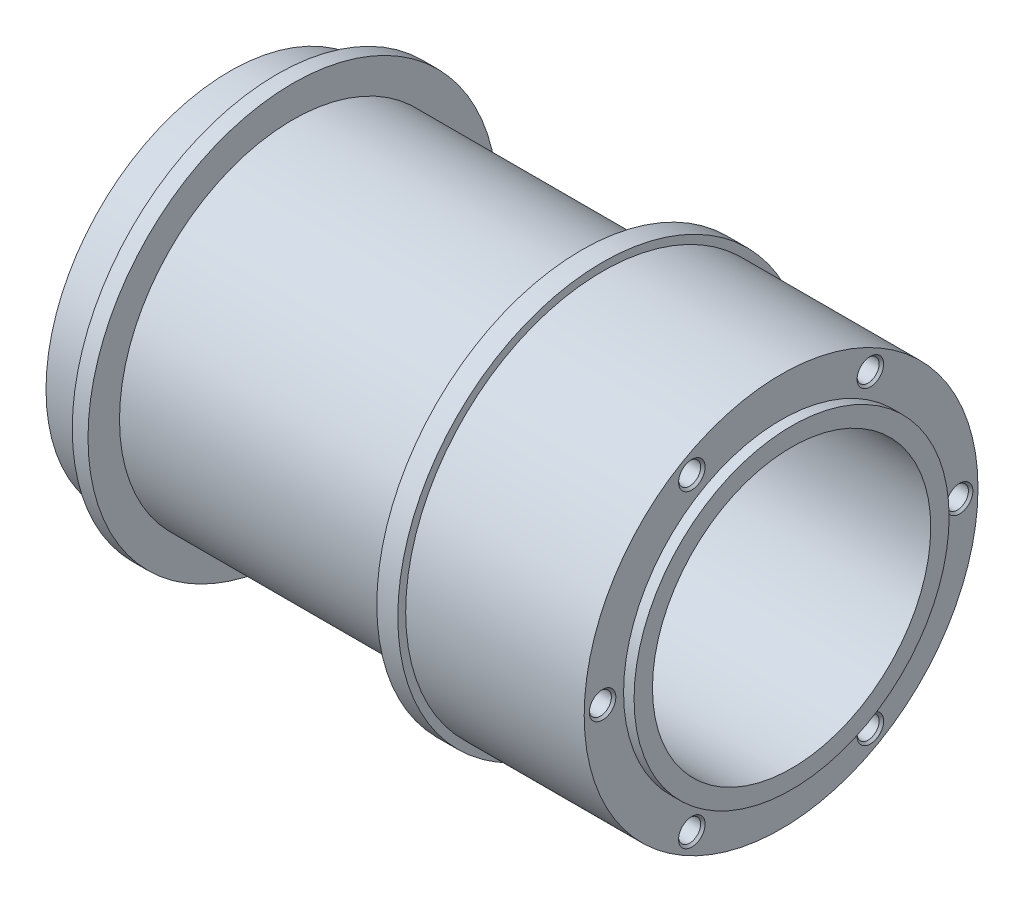
from build123d import *

# Parameters (mm, degrees)
OTW_R_GWINTOWANY_M51_D           = 4.2
OTW_R_GWINTOWANY_M51_DEPTH       = 14
OTW_R_GWINTOWANY_M51_CSINK_D     = 5.05
OTW_R_GWINTOWANY_M51_CSINK_ANGLE = 90
OTW_R_GWINTOWANY_M51_TIP         = 1.2618073
OTW_R_GWINTOWANY_M52_D           = 4.2
OTW_R_GWINTOWANY_M52_DEPTH       = 14
OTW_R_GWINTOWANY_M52_CSINK_D     = 5.05
OTW_R_GWINTOWANY_M52_CSINK_ANGLE = 90
OTW_R_GWINTOWANY_M52_TIP         = 1.2618073


with BuildPart() as part:
    # Szkic1 → Obrót1 (revolve)
    with BuildSketch(Plane.XY):
        Polygon((8.999999821, 35), (0, 35), (0, 26.5), (106.999999821, 26.5), (106.999999821, 30), (104.999999821, 30), (104.999999821, 37.5), (70.999999821, 37.5), (70.999999821, 39), (66.999999821, 39), (66.999999821, 33), (12, 33), (12, 39), (8.999999821, 39), align=None)
    revolve(axis=Axis((0, 0, 0), (1, 0, 0)))

    # Otwór gwintowany M51
    with Locations(Plane.ZY):
        with Locations((0, 30), (30, 0), (0, -30), (-30, 0)):
            CounterSinkHole(OTW_R_GWINTOWANY_M51_D / 2, OTW_R_GWINTOWANY_M51_CSINK_D / 2, depth=OTW_R_GWINTOWANY_M51_DEPTH, counter_sink_angle=OTW_R_GWINTOWANY_M51_CSINK_ANGLE)
            with Locations((0, 0, -(OTW_R_GWINTOWANY_M51_DEPTH + OTW_R_GWINTOWANY_M51_TIP / 2))):  # 118° drill point
                Cone(0, OTW_R_GWINTOWANY_M51_D / 2, OTW_R_GWINTOWANY_M51_TIP, mode=Mode.SUBTRACT)

    # Otwór gwintowany M52
    with Locations(Plane(origin=(104.999999821, 0, 0), x_dir=(0, 0, -1), z_dir=(1, 0, 0))):
        with Locations((17, 29.444863729), (34, 0), (17, -29.444863729), (0, 0), (-17, -29.444863729), (-34, 0), (-17, 29.444863729)):
            CounterSinkHole(OTW_R_GWINTOWANY_M52_D / 2, OTW_R_GWINTOWANY_M52_CSINK_D / 2, depth=OTW_R_GWINTOWANY_M52_DEPTH, counter_sink_angle=OTW_R_GWINTOWANY_M52_CSINK_ANGLE)
            with Locations((0, 0, -(OTW_R_GWINTOWANY_M52_DEPTH + OTW_R_GWINTOWANY_M52_TIP / 2))):  # 118° drill point
                Cone(0, OTW_R_GWINTOWANY_M52_D / 2, OTW_R_GWINTOWANY_M52_TIP, mode=Mode.SUBTRACT)


solid = part.part
